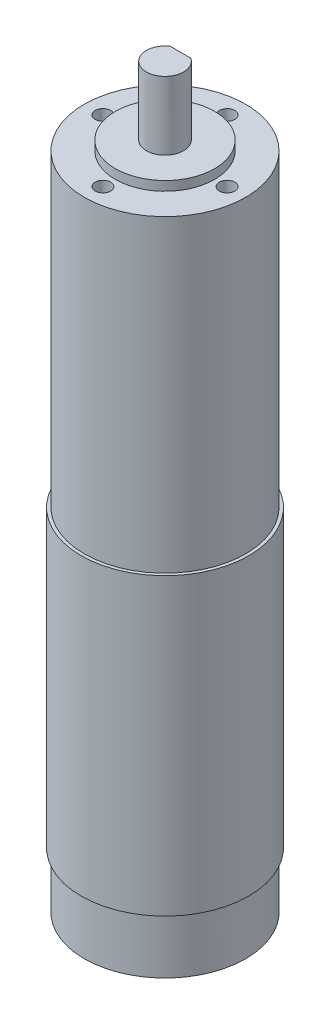
from build123d import *

# Parameters (mm, degrees)
SKETCH1_R           = 27
BOSS_EXTRUDE1_DEPTH = 95
SKETCH2_R           = 26
BOSS_EXTRUDE2_DEPTH = 99.5
SKETCH3_R           = 16
BOSS_EXTRUDE3_DEPTH = 3
SKETCH4_R           = 6
BOSS_EXTRUDE4_DEPTH = 22
CUT_EXTRUDE1_START  = -15
CUT_EXTRUDE1_DEPTH  = 15
SKETCH6_R           = 2.5
CUT_EXTRUDE2_DEPTH  = 10
BOSS_EXTRUDE5_START = 18
SKETCH7_R           = 26
BOSS_EXTRUDE5_DEPTH = 18


with BuildPart() as part:
    # Sketch1 → Boss-Extrude1 (new body)
    with BuildSketch(Plane(origin=(0, 0, 0), x_dir=(1, 0, 0), z_dir=(0, 1, 0))):
        Circle(SKETCH1_R)
    extrude(amount=BOSS_EXTRUDE1_DEPTH)

    # Sketch2 → Boss-Extrude2 (add)
    with BuildSketch(Plane(origin=(0, 95, 0), x_dir=(1, 0, 0), z_dir=(0, 1, 0))):
        Circle(SKETCH2_R)
    extrude(amount=BOSS_EXTRUDE2_DEPTH)

    # Sketch3 → Boss-Extrude3 (add)
    with BuildSketch(Plane(origin=(0, 194.5, 0), x_dir=(1, 0, 0), z_dir=(0, 1, 0))):
        Circle(SKETCH3_R)
    extrude(amount=BOSS_EXTRUDE3_DEPTH)

    # Sketch4 → Boss-Extrude4 (add)
    with BuildSketch(Plane(origin=(0, 197.5, 0), x_dir=(1, 0, 0), z_dir=(0, 1, 0))):
        Circle(SKETCH4_R)
    extrude(amount=BOSS_EXTRUDE4_DEPTH)

    # Sketch5 → Cut-Extrude1 (cut)
    with BuildSketch(Plane(origin=(0, 219.5, 0), x_dir=(1, 0, 0), z_dir=(0, 1, 0)).offset(CUT_EXTRUDE1_START)):
        with BuildLine():
            Line((-3.31662479, 5), (3.31662479, 5))
            ThreePointArc((3.31662479, 5), (0, 6), (-3.31662479, 5))
        make_face()
    extrude(amount=CUT_EXTRUDE1_DEPTH, mode=Mode.SUBTRACT)

    # Sketch6 → Cut-Extrude2 (cut)
    with BuildSketch(Plane(origin=(0, 194.5, 0), x_dir=(1, 0, 0), z_dir=(0, 1, 0))):
        with Locations((0, 20)):
            Circle(SKETCH6_R)
        with Locations((-20, 0)):
            Circle(SKETCH6_R)
        with Locations((0, -20)):
            Circle(SKETCH6_R)
        with Locations((20, 0)):
            Circle(SKETCH6_R)
    extrude(amount=-CUT_EXTRUDE2_DEPTH, mode=Mode.SUBTRACT)

    # Sketch7 → Boss-Extrude5 (add)
    with BuildSketch(Plane.XZ.offset(BOSS_EXTRUDE5_START)):
        Circle(SKETCH7_R)
    extrude(amount=-BOSS_EXTRUDE5_DEPTH)


solid = part.part
